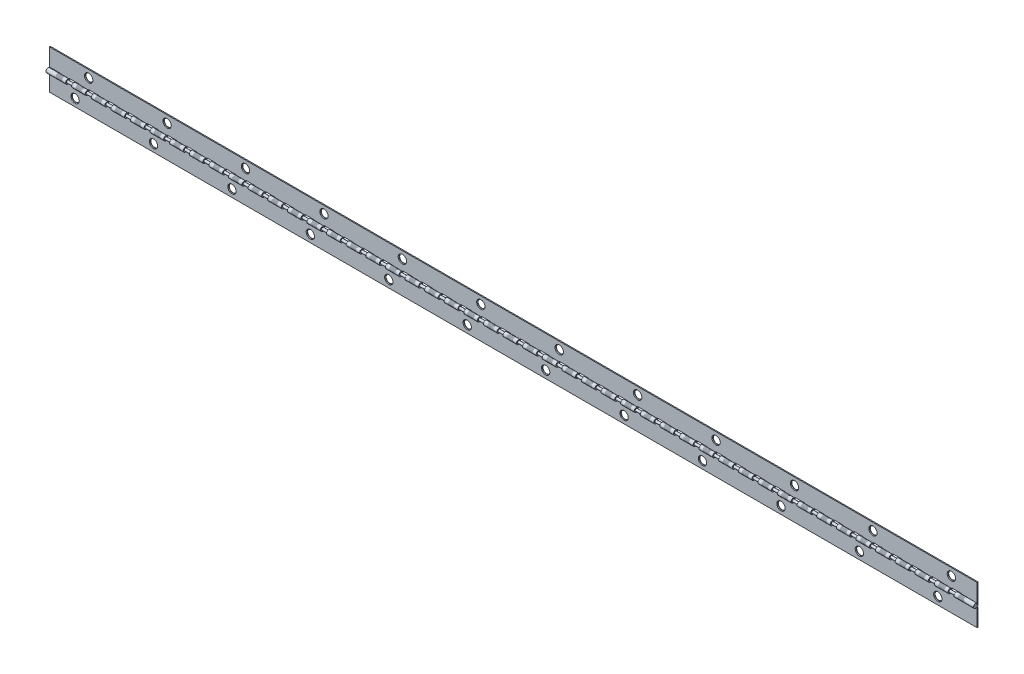
from build123d import *

# Parameters (mm, degrees)
BOSS_EXTRUDE2_DEPTH          = 300.4
SKETCH6_W                    = 6.35
SKETCH6_H                    = 2.8702
CUT_EXTRUDE1_DEPTH           = 301.671763742
LPATTERN1_COUNT              = 47
LPATTERN1_PITCH              = 12.7
CUT_EXTRUDE2_START           = 0.238125
SKETCH8_R                    = 2.3622
CUT_EXTRUDE2_DEPTH           = 0.635
CUT_EXTRUDE2_TAPER           = -41
CUT_EXTRUDE2_OTHER_WAY_DEPTH = 301.68203812
CIRPATTERN1_COUNT            = 2
CUT_EXTRUDE3_START           = -0.793753
SKETCH9_R                    = 0.478366667
CUT_EXTRUDE3_DEPTH           = 0.793754
LPATTERN3_COUNT              = 47
LPATTERN3_PITCH              = 12.7
SKETCH10_R                   = 0.79375
BOSS_EXTRUDE3_DEPTH          = 300.4


# Read off the part's stored shape, not the designer's step: LPattern2
with BuildPart() as part:
    # Sketch5 → Boss-Extrude2 (new, symmetric)
    with BuildSketch(Plane(origin=(0, 0, 0), x_dir=(0, 0, -1), z_dir=(1, 0, 0))):
        with BuildLine():
            Line((0.606499467, -1.300642305), (0.338136871, -0.72513686))
            ThreePointArc((0.338136871, -0.72513686), (-0.674797496, 0.429893417), (0.8001, 0))
            Line((0.8001, 0), (0.8001, -12.7))
            Line((0.8001, -12.7), (1.4351, -12.7))
            Line((1.4351, -12.7), (1.4351, 0))
            ThreePointArc((1.4351, 0), (-1.210351064, 0.771078668), (0.606499467, -1.300642305))
        make_face()
    extrude(amount=BOSS_EXTRUDE2_DEPTH, both=True)

    # Sketch6 → Cut-Extrude1 (cut, symmetric)
    with BuildSketch(Plane.XY):
        with Locations((297.225, 0)):
            Rectangle(SKETCH6_W, SKETCH6_H)
    cut_extrude1 = extrude(amount=CUT_EXTRUDE1_DEPTH, both=True, mode=Mode.SUBTRACT)

    # LPattern1: Cut-Extrude1 ×47
    with Locations(*[(-i * LPATTERN1_PITCH, 0, 0) for i in range(1, LPATTERN1_COUNT)]):
        add(cut_extrude1, mode=Mode.SUBTRACT)

    # Sketch8 → Cut-Extrude2 (cut)
    with BuildSketch(Plane.XY.offset(-1.4351).offset(CUT_EXTRUDE2_START)):
        with Locations((275, -7.9375)):
            Circle(SKETCH8_R)
    extrude(amount=CUT_EXTRUDE2_DEPTH, taper=CUT_EXTRUDE2_TAPER, mode=Mode.SUBTRACT)

    # Sketch8 → Cut-Extrude2 other way (cut)
    with BuildSketch(Plane.XY.offset(-1.4351).offset(CUT_EXTRUDE2_START)):
        with Locations((275, -7.9375)):
            Circle(SKETCH8_R)
    extrude(amount=-CUT_EXTRUDE2_OTHER_WAY_DEPTH, mode=Mode.SUBTRACT)

    # LPattern2 outline → LPattern2 (revolve, cut)
    with BuildSketch(Plane(origin=(-283.8, -7.9375, 0), x_dir=(1, 0, 0), z_dir=(0, -1, 0))):
        Polygon((0, -1.4351), (2.3622, -1.4351), (2.3622, -1.196975), (2.707198174, -0.8001), (0, -0.8001), align=None)
    revolve(axis=Axis((-283.8, -7.9375, 0), (0, 0, 1)), mode=Mode.SUBTRACT)

    # LPattern2 2 outline → LPattern2 2 (revolve, cut)
    with BuildSketch(Plane(origin=(-233, -7.9375, 0), x_dir=(1, 0, 0), z_dir=(0, -1, 0))):
        Polygon((0, -1.4351), (2.3622, -1.4351), (2.3622, -1.196975), (2.707198174, -0.8001), (0, -0.8001), align=None)
    revolve(axis=Axis((-233, -7.9375, 0), (0, 0, 1)), mode=Mode.SUBTRACT)

    # LPattern2 3 outline → LPattern2 3 (revolve, cut)
    with BuildSketch(Plane(origin=(-182.2, -7.9375, 0), x_dir=(1, 0, 0), z_dir=(0, -1, 0))):
        Polygon((0, -1.4351), (2.3622, -1.4351), (2.3622, -1.196975), (2.707198174, -0.8001), (0, -0.8001), align=None)
    revolve(axis=Axis((-182.2, -7.9375, 0), (0, 0, 1)), mode=Mode.SUBTRACT)

    # LPattern2 4 outline → LPattern2 4 (revolve, cut)
    with BuildSketch(Plane(origin=(-131.4, -7.9375, 0), x_dir=(1, 0, 0), z_dir=(0, -1, 0))):
        Polygon((0, -1.4351), (2.3622, -1.4351), (2.3622, -1.196975), (2.707198174, -0.8001), (0, -0.8001), align=None)
    revolve(axis=Axis((-131.4, -7.9375, 0), (0, 0, 1)), mode=Mode.SUBTRACT)

    # LPattern2 5 outline → LPattern2 5 (revolve, cut)
    with BuildSketch(Plane(origin=(-80.6, -7.9375, 0), x_dir=(1, 0, 0), z_dir=(0, -1, 0))):
        Polygon((0, -1.4351), (2.3622, -1.4351), (2.3622, -1.196975), (2.707198174, -0.8001), (0, -0.8001), align=None)
    revolve(axis=Axis((-80.6, -7.9375, 0), (0, 0, 1)), mode=Mode.SUBTRACT)

    # LPattern2 6 outline → LPattern2 6 (revolve, cut)
    with BuildSketch(Plane(origin=(-29.8, -7.9375, 0), x_dir=(1, 0, 0), z_dir=(0, -1, 0))):
        Polygon((0, -1.4351), (2.3622, -1.4351), (2.3622, -1.196975), (2.707198174, -0.8001), (0, -0.8001), align=None)
    revolve(axis=Axis((-29.8, -7.9375, 0), (0, 0, 1)), mode=Mode.SUBTRACT)

    # LPattern2 7 outline → LPattern2 7 (revolve, cut)
    with BuildSketch(Plane(origin=(21, -7.9375, 0), x_dir=(1, 0, 0), z_dir=(0, -1, 0))):
        Polygon((0, -1.4351), (2.3622, -1.4351), (2.3622, -1.196975), (2.707198174, -0.8001), (0, -0.8001), align=None)
    revolve(axis=Axis((21, -7.9375, 0), (0, 0, 1)), mode=Mode.SUBTRACT)

    # LPattern2 8 outline → LPattern2 8 (revolve, cut)
    with BuildSketch(Plane(origin=(71.8, -7.9375, 0), x_dir=(1, 0, 0), z_dir=(0, -1, 0))):
        Polygon((0, -1.4351), (2.3622, -1.4351), (2.3622, -1.196975), (2.707198174, -0.8001), (0, -0.8001), align=None)
    revolve(axis=Axis((71.8, -7.9375, 0), (0, 0, 1)), mode=Mode.SUBTRACT)

    # LPattern2 9 outline → LPattern2 9 (revolve, cut)
    with BuildSketch(Plane(origin=(122.6, -7.9375, 0), x_dir=(1, 0, 0), z_dir=(0, -1, 0))):
        Polygon((0, -1.4351), (2.3622, -1.4351), (2.3622, -1.196975), (2.707198174, -0.8001), (0, -0.8001), align=None)
    revolve(axis=Axis((122.6, -7.9375, 0), (0, 0, 1)), mode=Mode.SUBTRACT)

    # LPattern2 10 outline → LPattern2 10 (revolve, cut)
    with BuildSketch(Plane(origin=(173.4, -7.9375, 0), x_dir=(1, 0, 0), z_dir=(0, -1, 0))):
        Polygon((0, -1.4351), (2.3622, -1.4351), (2.3622, -1.196975), (2.707198174, -0.8001), (0, -0.8001), align=None)
    revolve(axis=Axis((173.4, -7.9375, 0), (0, 0, 1)), mode=Mode.SUBTRACT)

    # LPattern2 11 outline → LPattern2 11 (revolve, cut)
    with BuildSketch(Plane(origin=(224.2, -7.9375, 0), x_dir=(1, 0, 0), z_dir=(0, -1, 0))):
        Polygon((2.707198174, -0.8001), (0, -0.8001), (0, -1.4351), (2.3622, -1.4351), (2.3622, -1.196975), align=None)
    revolve(axis=Axis((224.2, -7.9375, 0), (0, 0, 1)), mode=Mode.SUBTRACT)


with BuildPart() as cirpattern1_1:
    # CirPattern1: pattern copy
    add(part.part.rotate(Axis((0, 0, 0), (0, 0, 1)), 1 * 360 / CIRPATTERN1_COUNT))

    # Sketch9 → Cut-Extrude3 (cut)
    with BuildSketch(Plane(origin=(0, 0, -1.4351), x_dir=(-1, 0, 0), z_dir=(0, 0, -1)).offset(CUT_EXTRUDE3_START)):
        with Locations((-296.2725, 0)):
            Circle(SKETCH9_R)
    cut_extrude3 = extrude(amount=CUT_EXTRUDE3_DEPTH, mode=Mode.SUBTRACT)

    # LPattern3: Cut-Extrude3 ×47
    with Locations(*[(-i * LPATTERN3_PITCH, 0, 0) for i in range(1, LPATTERN3_COUNT)]):
        add(cut_extrude3, mode=Mode.SUBTRACT)


with BuildPart() as body_3:
    # Sketch10 → Boss-Extrude3 (new, symmetric)
    with BuildSketch(Plane(origin=(0, 0, 0), x_dir=(0, 0, -1), z_dir=(1, 0, 0))):
        Circle(SKETCH10_R)
    extrude(amount=BOSS_EXTRUDE3_DEPTH, both=True)


solid = Compound([part.part, cirpattern1_1.part, body_3.part])
